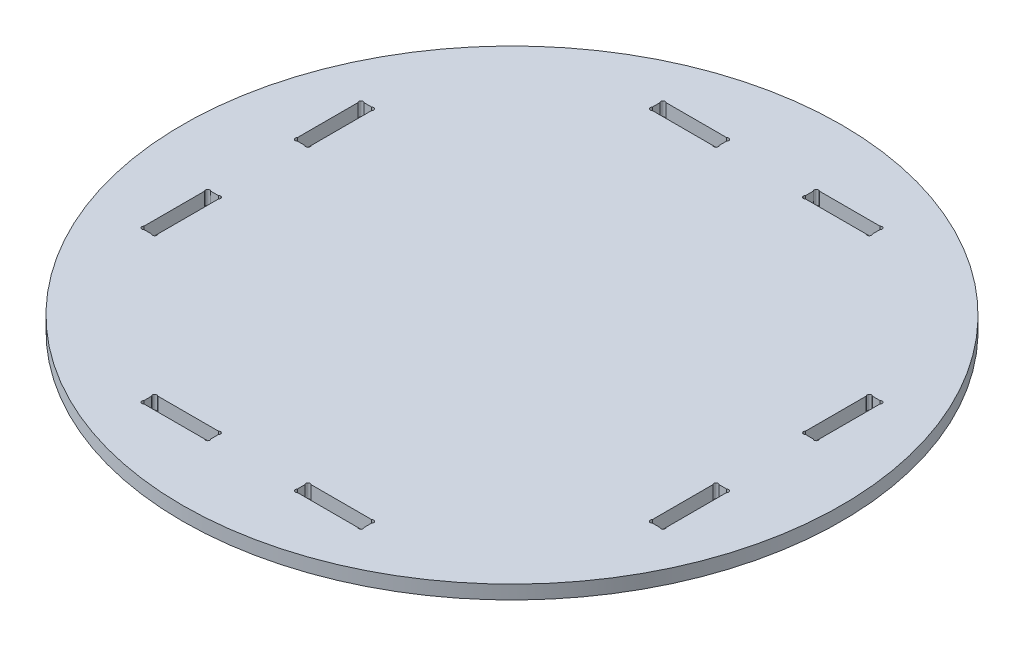
from build123d import *

# Parameters (mm, degrees)
SKETCH1_R                   = 76.1
BOSS_EXTRUDE1_DEPTH         = 3.175
SKETCH3_W                   = 15.4
SKETCH3_H                   = 3.175
CUT_EXTRUDE1_DEPTH          = 108.66847554
SKETCH4_R                   = 0.5
CUT_EXTRUDE2_DEPTH          = 108.66847554
SKETCH_PATTERN1_DEPTH       = 3.175
CIRPATTERN1_COUNT           = 4
CIRPATTERN1_COPY_1_SKETCH_R = 0.5
CIRPATTERN1_COPY_1_DEPTH    = 108.66847554
CIRPATTERN1_COPY_2_SKETCH_R = 0.5
CIRPATTERN1_COPY_2_DEPTH    = 108.66847554
CIRPATTERN1_COPY_3_SKETCH_R = 0.5
CIRPATTERN1_COPY_3_DEPTH    = 108.66847554
CIRPATTERN1_COPY_4_DEPTH    = 3.175
CIRPATTERN1_COPY_5_DEPTH    = 3.175
CIRPATTERN1_COPY_6_DEPTH    = 3.175


# Read off the part's stored shape, not the designer's step: Sketch-Pattern1
with BuildPart() as part:
    # Sketch1 → Boss-Extrude1 (new body)
    with BuildSketch(Plane(origin=(0, 0, 0), x_dir=(1, 0, 0), z_dir=(0, 1, 0))):
        with Locations(Location((0, 0, 0), (0, 0, 270))):
            Circle(SKETCH1_R)
    extrude(amount=BOSS_EXTRUDE1_DEPTH)

    # Sketch3 → Cut-Extrude1 (cut, symmetric)
    with BuildSketch(Plane(origin=(0, 3.175, 0), x_dir=(1, 0, 0), z_dir=(0, 1, 0))):
        with Locations((-17.7, 58.6875)):
            Rectangle(SKETCH3_W, SKETCH3_H)
        with Locations((17.7, 58.6875)):
            Rectangle(SKETCH3_W, SKETCH3_H)
    cut_extrude1 = extrude(amount=CUT_EXTRUDE1_DEPTH, both=True, mode=Mode.SUBTRACT)

    # Sketch4 → Cut-Extrude2 (cut, symmetric)
    with BuildSketch(Plane(origin=(0, 3.175, 0), x_dir=(1, 0, 0), z_dir=(0, 1, 0))):
        with Locations((-25.046446609, 59.921446609)):
            Circle(SKETCH4_R)
        with Locations((-25.046446609, 57.453553391)):
            Circle(SKETCH4_R)
    cut_extrude2 = extrude(amount=CUT_EXTRUDE2_DEPTH, both=True, mode=Mode.SUBTRACT)

    # Sketch-Pattern1 outline → Sketch-Pattern1 (cut)
    with BuildSketch(Plane(origin=(0, 0, 0), x_dir=(1, 0, 0), z_dir=(0, 1, 0))):
        with BuildLine():
            Line((10, 60.275), (10.707106781, 60.275))
            ThreePointArc((10.707106781, 60.275), (10.353553391, 60.421446609), (10, 60.275))
        make_face()
        with BuildLine():
            Line((10.707106781, 57.1), (10, 57.1))
            ThreePointArc((10, 57.1), (10.353553391, 56.953553391), (10.707106781, 57.1))
        make_face()
        with BuildLine():
            Line((10, 57.1), (10, 57.807106781))
            ThreePointArc((10, 57.807106781), (9.853553391, 57.453553391), (10, 57.1))
        make_face()
        with BuildLine():
            Line((10, 59.567893219), (10, 60.275))
            ThreePointArc((10, 60.275), (9.853553391, 59.921446609), (10, 59.567893219))
        make_face()
    sketch_pattern1 = extrude(amount=SKETCH_PATTERN1_DEPTH, mode=Mode.SUBTRACT)

    # Mirror1: Cut-Extrude2, Sketch-Pattern1 across plane
    add(cut_extrude2.mirror(Plane(origin=(0, 0, 0), x_dir=(0, 0, 1), z_dir=(1, 0, 0))), mode=Mode.SUBTRACT)
    add(sketch_pattern1.mirror(Plane(origin=(0, 0, 0), x_dir=(0, 0, 1), z_dir=(1, 0, 0))), mode=Mode.SUBTRACT)

    # CirPattern1: Cut-Extrude1, Cut-Extrude2, Sketch-Pattern1 ×4 about axis
    cirpattern1_axis = Axis((0, 0, 0), (0, 1, 0))
    add([cut_extrude1.rotate(cirpattern1_axis, i * 360 / CIRPATTERN1_COUNT) for i in range(1, CIRPATTERN1_COUNT)], mode=Mode.SUBTRACT)
    add([cut_extrude2.rotate(cirpattern1_axis, i * 360 / CIRPATTERN1_COUNT) for i in range(1, CIRPATTERN1_COUNT)], mode=Mode.SUBTRACT)
    add([sketch_pattern1.rotate(cirpattern1_axis, i * 360 / CIRPATTERN1_COUNT) for i in range(1, CIRPATTERN1_COUNT)], mode=Mode.SUBTRACT)

    # CirPattern1 copy 1 sketch → CirPattern1 copy 1 (cut, symmetric)
    with BuildSketch(Plane.ZX.offset(3.175)):
        with Locations((-25.046446609, -59.921446609)):
            Circle(CIRPATTERN1_COPY_1_SKETCH_R)
        with Locations((-25.046446609, -57.453553391)):
            Circle(CIRPATTERN1_COPY_1_SKETCH_R)
    extrude(amount=CIRPATTERN1_COPY_1_DEPTH, both=True, mode=Mode.SUBTRACT)

    # CirPattern1 copy 2 sketch → CirPattern1 copy 2 (cut, symmetric)
    with BuildSketch(Plane(origin=(0, 3.175, 0), x_dir=(1, 0, 0), z_dir=(0, 1, 0))):
        with Locations((-25.046446609, -59.921446609)):
            Circle(CIRPATTERN1_COPY_2_SKETCH_R)
        with Locations((-25.046446609, -57.453553391)):
            Circle(CIRPATTERN1_COPY_2_SKETCH_R)
    extrude(amount=CIRPATTERN1_COPY_2_DEPTH, both=True, mode=Mode.SUBTRACT)

    # CirPattern1 copy 3 sketch → CirPattern1 copy 3 (cut, symmetric)
    with BuildSketch(Plane(origin=(0, 3.175, 0), x_dir=(0, 0, -1), z_dir=(0, 1, 0))):
        with Locations((-25.046446609, -59.921446609)):
            Circle(CIRPATTERN1_COPY_3_SKETCH_R)
        with Locations((-25.046446609, -57.453553391)):
            Circle(CIRPATTERN1_COPY_3_SKETCH_R)
    extrude(amount=CIRPATTERN1_COPY_3_DEPTH, both=True, mode=Mode.SUBTRACT)

    # CirPattern1 copy 4 sketch → CirPattern1 copy 4 (cut)
    with BuildSketch(Plane.ZX):
        with BuildLine():
            Line((10, -60.275), (10.707106781, -60.275))
            ThreePointArc((10.707106781, -60.275), (10.353553391, -60.421446609), (10, -60.275))
        make_face()
        with BuildLine():
            Line((10.707106781, -57.1), (10, -57.1))
            ThreePointArc((10, -57.1), (10.353553391, -56.953553391), (10.707106781, -57.1))
        make_face()
        with BuildLine():
            Line((10, -57.1), (10, -57.807106781))
            ThreePointArc((10, -57.807106781), (9.853553391, -57.453553391), (10, -57.1))
        make_face()
        with BuildLine():
            Line((10, -59.567893219), (10, -60.275))
            ThreePointArc((10, -60.275), (9.853553391, -59.921446609), (10, -59.567893219))
        make_face()
    extrude(amount=CIRPATTERN1_COPY_4_DEPTH, mode=Mode.SUBTRACT)

    # CirPattern1 copy 5 sketch → CirPattern1 copy 5 (cut)
    with BuildSketch(Plane(origin=(0, 0, 0), x_dir=(1, 0, 0), z_dir=(0, 1, 0))):
        with BuildLine():
            Line((10, -60.275), (10.707106781, -60.275))
            ThreePointArc((10.707106781, -60.275), (10.353553391, -60.421446609), (10, -60.275))
        make_face()
        with BuildLine():
            Line((10.707106781, -57.1), (10, -57.1))
            ThreePointArc((10, -57.1), (10.353553391, -56.953553391), (10.707106781, -57.1))
        make_face()
        with BuildLine():
            Line((10, -57.1), (10, -57.807106781))
            ThreePointArc((10, -57.807106781), (9.853553391, -57.453553391), (10, -57.1))
        make_face()
        with BuildLine():
            Line((10, -59.567893219), (10, -60.275))
            ThreePointArc((10, -60.275), (9.853553391, -59.921446609), (10, -59.567893219))
        make_face()
    extrude(amount=CIRPATTERN1_COPY_5_DEPTH, mode=Mode.SUBTRACT)

    # CirPattern1 copy 6 sketch → CirPattern1 copy 6 (cut)
    with BuildSketch(Plane(origin=(0, 0, 0), x_dir=(0, 0, -1), z_dir=(0, 1, 0))):
        with BuildLine():
            Line((10, -60.275), (10.707106781, -60.275))
            ThreePointArc((10.707106781, -60.275), (10.353553391, -60.421446609), (10, -60.275))
        make_face()
        with BuildLine():
            Line((10.707106781, -57.1), (10, -57.1))
            ThreePointArc((10, -57.1), (10.353553391, -56.953553391), (10.707106781, -57.1))
        make_face()
        with BuildLine():
            Line((10, -57.1), (10, -57.807106781))
            ThreePointArc((10, -57.807106781), (9.853553391, -57.453553391), (10, -57.1))
        make_face()
        with BuildLine():
            Line((10, -59.567893219), (10, -60.275))
            ThreePointArc((10, -60.275), (9.853553391, -59.921446609), (10, -59.567893219))
        make_face()
    extrude(amount=CIRPATTERN1_COPY_6_DEPTH, mode=Mode.SUBTRACT)


solid = part.part
